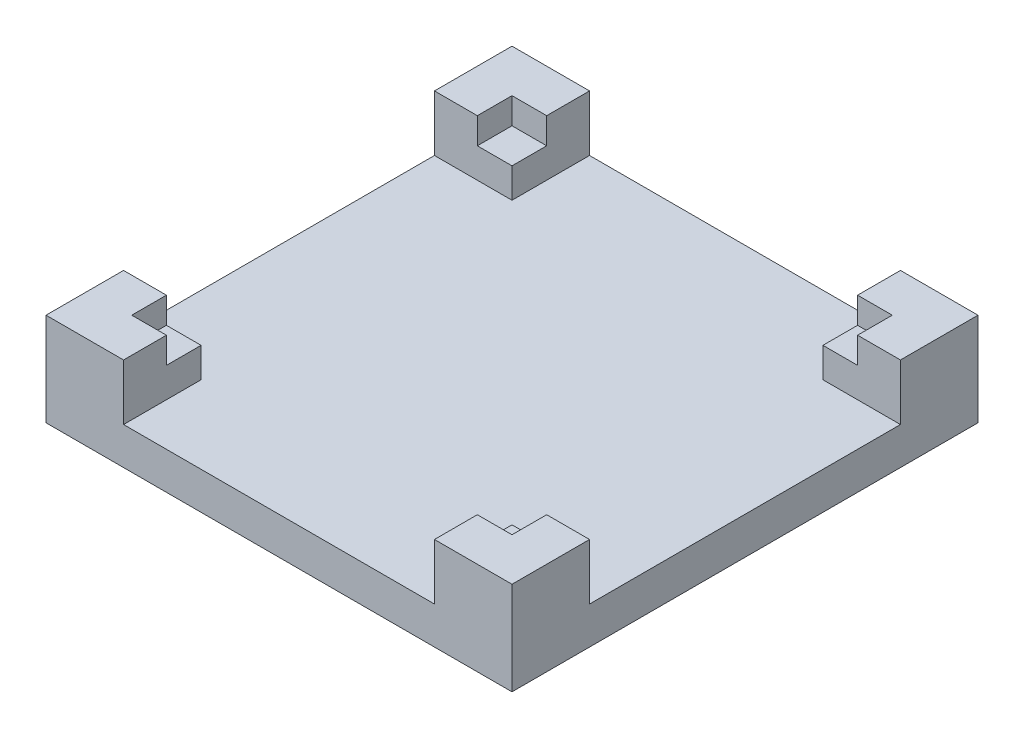
from build123d import *

# Parameters (mm, degrees)
SKETCH1_W           = 125
SKETCH1_H           = 125
BOSS_EXTRUDE1_DEPTH = 25
SKETCH2_W           = 102
SKETCH2_H           = 102
CUT_EXTRUDE1_DEPTH  = 15
SKETCH4_W           = 83.4
SKETCH4_H           = 11.5
SKETCH4_W_2         = 11.5
SKETCH4_H_2         = 83.4
CUT_EXTRUDE2_DEPTH  = 15
SKETCH5_W           = 9.3
SKETCH5_H           = 9.3
BOSS_EXTRUDE2_DEPTH = 8


with BuildPart() as part:
    # Sketch1 → Boss-Extrude1 (new body)
    with BuildSketch(Plane(origin=(0, 0, 0), x_dir=(1, 0, 0), z_dir=(0, 1, 0))):
        with Locations((62.5, 62.5)):
            Rectangle(SKETCH1_W, SKETCH1_H)
    extrude(amount=BOSS_EXTRUDE1_DEPTH)

    # Sketch2 → Cut-Extrude1 (cut)
    with BuildSketch(Plane(origin=(0, 25, 0), x_dir=(1, 0, 0), z_dir=(0, 1, 0))):
        with Locations((62.5, 62.5)):
            Rectangle(SKETCH2_W, SKETCH2_H)
    extrude(amount=-CUT_EXTRUDE1_DEPTH, mode=Mode.SUBTRACT)

    # Sketch4 → Cut-Extrude2 (cut)
    with BuildSketch(Plane(origin=(0, 25, 0), x_dir=(1, 0, 0), z_dir=(0, 1, 0))):
        with Locations((62.5, 119.25)):
            Rectangle(SKETCH4_W, SKETCH4_H)
        with Locations((5.75, 62.5)):
            Rectangle(SKETCH4_W_2, SKETCH4_H_2)
        with Locations((62.5, 5.75)):
            Rectangle(SKETCH4_W, SKETCH4_H)
        with Locations((119.25, 62.5)):
            Rectangle(SKETCH4_W_2, SKETCH4_H_2)
    extrude(amount=-CUT_EXTRUDE2_DEPTH, mode=Mode.SUBTRACT)

    # Sketch5 → Boss-Extrude2 (add)
    with BuildSketch(Plane(origin=(0, 10, 0), x_dir=(1, 0, 0), z_dir=(0, 1, 0))):
        with Locations((108.85, 16.15)):
            Rectangle(SKETCH5_W, SKETCH5_H)
        with Locations((16.15, 16.15)):
            Rectangle(SKETCH5_W, SKETCH5_H)
        with Locations((16.15, 108.85)):
            Rectangle(SKETCH5_W, SKETCH5_H)
        with Locations((108.85, 108.85)):
            Rectangle(SKETCH5_W, SKETCH5_H)
    extrude(amount=BOSS_EXTRUDE2_DEPTH)


solid = part.part
